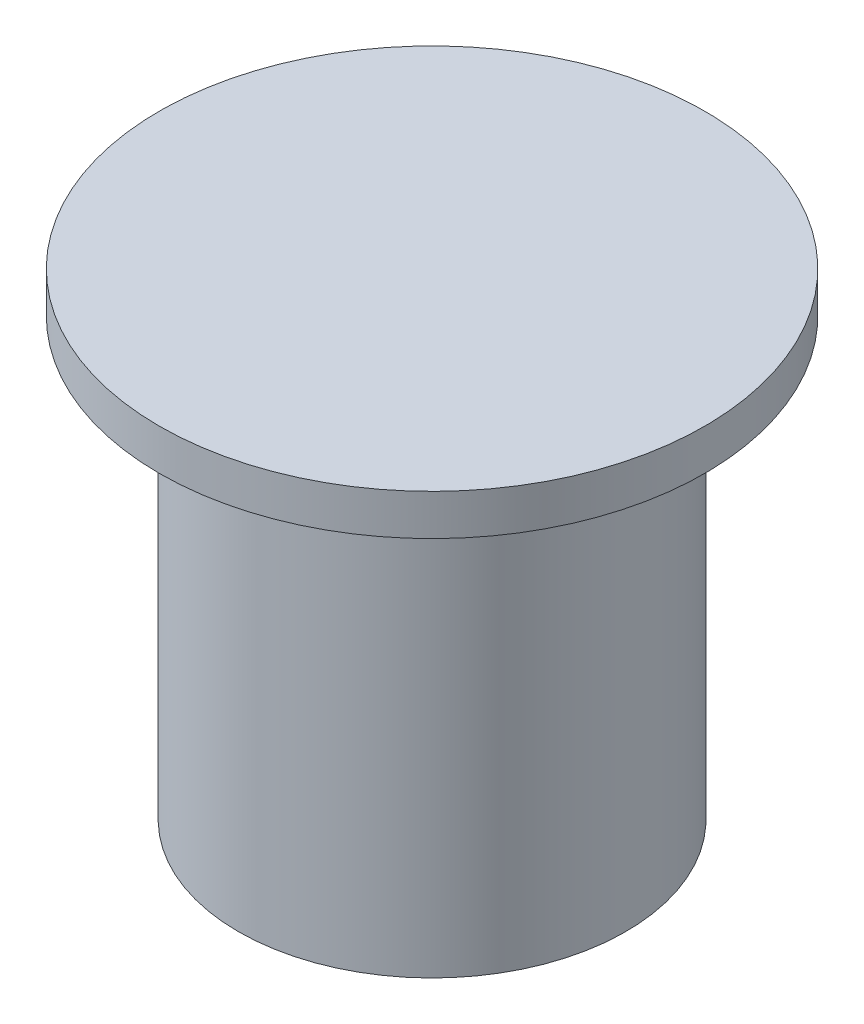
from build123d import *

# Parameters (mm, degrees)
SKETCH1_R           = 7.1
BOSS_EXTRUDE1_DEPTH = 16
SKETCH2_R           = 10
BOSS_EXTRUDE2_DEPTH = 1.5


with BuildPart() as part:
    # Sketch1 → Boss-Extrude1 (new body)
    with BuildSketch(Plane(origin=(0, 0, 0), x_dir=(1, 0, 0), z_dir=(0, 1, 0))):
        Circle(SKETCH1_R)
    extrude(amount=BOSS_EXTRUDE1_DEPTH)

    # Sketch2 → Boss-Extrude2 (add)
    with BuildSketch(Plane(origin=(0, 16, 0), x_dir=(1, 0, 0), z_dir=(0, 1, 0))):
        Circle(SKETCH2_R)
    extrude(amount=BOSS_EXTRUDE2_DEPTH)


solid = part.part
